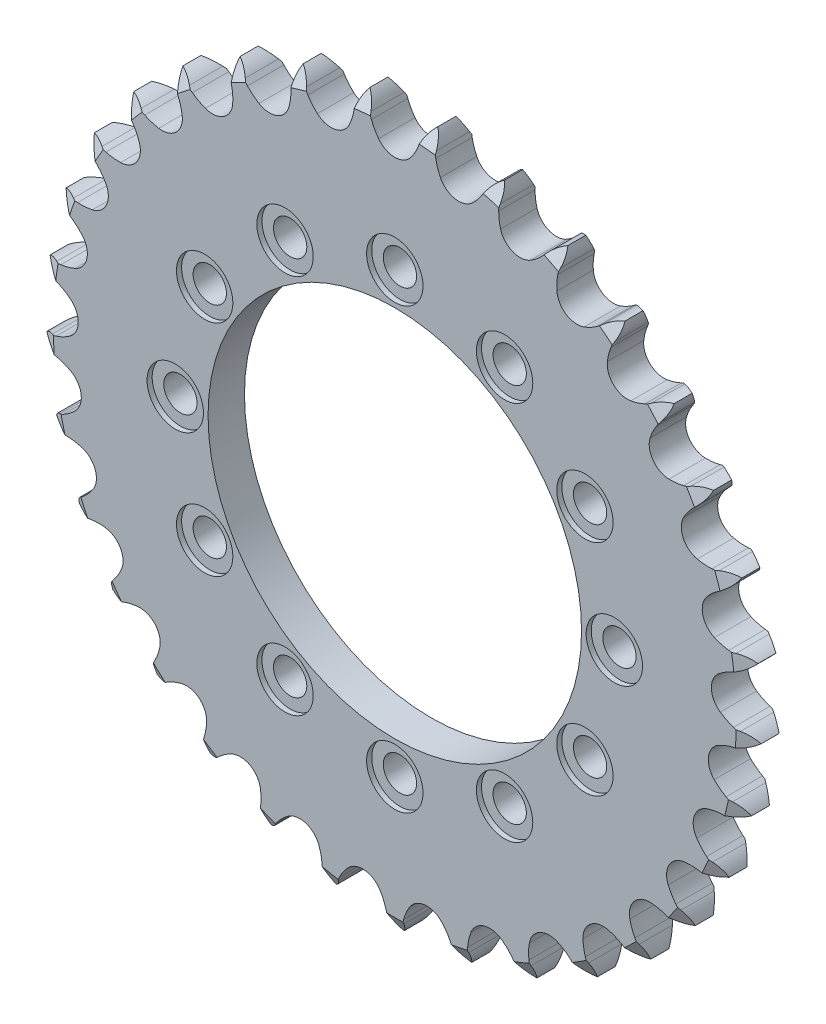
from build123d import *

# Parameters (mm, degrees)
EXTRUSION_DEPTH         = 7.2136
CIRPATTERN1_COUNT       = 12
CUT_EXTRUDE1_DEPTH      = 101.397293257
CUT_EXTRUDE1_DEPTH_BACK = 101.397293257
SKETCH8_R               = 37
CUT_EXTRUDE2_START      = 7.2136
SKETCH10_R              = 5.588
CUT_EXTRUDE2_DEPTH      = 1.016
CIRPATTERN2_COUNT       = 12


with BuildPart() as part:
    # Teeth Sketch → Extrusion (new body)
    with BuildSketch(Plane.XY):
        with BuildLine():
            ThreePointArc((6.734552875, 70.527428506), (5.727412099, 69.369502295), (5.022388138, 68.006393031))
            Line((5.022388138, 68.006393031), (4.635162245, 66.971544668))
            ThreePointArc((4.635162245, 66.971544668), (4.0137299, 65.635158722), (3.209237245, 64.400291471))
            ThreePointArc((3.209237245, 64.400291471), (0, 62.793862006), (-3.209237245, 64.400291471))
            ThreePointArc((-3.209237245, 64.400291471), (-4.0137299, 65.635158722), (-4.635162245, 66.971544668))
            Line((-4.635162245, 66.971544668), (-5.022388138, 68.006393031))
            ThreePointArc((-5.022388138, 68.006393031), (-5.727412099, 69.369502295), (-6.734552875, 70.527428506))
            ThreePointArc((-6.734552875, 70.527428506), (-7.504354329, 69.199824885), (-7.938667464, 67.727922119))
            Line((-7.938667464, 67.727922119), (-8.123049341, 66.638491832))
            ThreePointArc((-8.123049341, 66.638491832), (-8.48033889, 65.208649276), (-9.036593151, 63.84384645))
            ThreePointArc((-9.036593151, 63.84384645), (-11.883816523, 61.659095115), (-15.339077445, 62.629142165))
            ThreePointArc((-15.339077445, 62.629142165), (-16.362732034, 63.68944252), (-17.22584699, 64.884071387))
            Line((-17.22584699, 64.884071387), (-17.801921547, 65.826935709))
            ThreePointArc((-17.801921547, 65.826935709), (-18.752174931, 67.031985151), (-19.960254337, 67.978383482))
            ThreePointArc((-19.960254337, 67.978383482), (-20.464893839, 66.529085505), (-20.61279894, 65.001587639))
            Line((-20.61279894, 65.001587639), (-20.587672758, 63.896950277))
            ThreePointArc((-20.587672758, 63.896950277), (-20.667906137, 62.425329346), (-20.955817525, 60.979918474))
            ThreePointArc((-20.955817525, 60.979918474), (-23.338120953, 58.295807876), (-26.914523421, 58.594412483))
            ThreePointArc((-26.914523421, 58.594412483), (-28.120342399, 59.441823925), (-29.193944743, 60.451518712))
            Line((-29.193944743, 60.451518712), (-29.938047129, 61.268321421))
            ThreePointArc((-29.938047129, 61.268321421), (-31.099185303, 62.271757414), (-32.464540202, 62.972422563))
            ThreePointArc((-32.464540202, 62.972422563), (-32.685778765, 61.453811636), (-32.541930156, 59.925926421))
            Line((-32.541930156, 59.925926421), (-32.308204042, 58.846006456))
            ThreePointArc((-32.308204042, 58.846006456), (-32.108481407, 57.385795366), (-32.117644055, 55.912017363))
            ThreePointArc((-32.117644055, 55.912017363), (-33.948924886, 52.825558252), (-37.517208396, 52.441928068))
            ThreePointArc((-37.517208396, 52.441928068), (-38.861610323, 53.045822938), (-40.106897269, 53.834090646))
            Line((-40.106897269, 53.834090646), (-40.992133685, 54.495310364))
            ThreePointArc((-40.992133685, 54.495310364), (-42.32219009, 55.260866117), (-43.795472998, 55.69047422))
            ThreePointArc((-43.795472998, 55.69047422), (-43.725314484, 54.157436897), (-43.294911229, 52.684386087))
            Line((-43.294911229, 52.684386087), (-42.861032653, 51.668214641))
            ThreePointArc((-42.861032653, 51.668214641), (-42.388572501, 50.272189225), (-42.118655247, 48.823310267))
            ThreePointArc((-42.118655247, 48.823310267), (-43.33272622, 45.446055318), (-46.763923708, 44.394055736))
            ThreePointArc((-46.763923708, 44.394055736), (-48.198318397, 44.732607702), (-49.570282031, 45.270958281))
            Line((-49.570282031, 45.270958281), (-50.564657725, 45.752696804))
            ThreePointArc((-50.564657725, 45.752696804), (-52.015560657, 46.252703137), (-53.543523293, 46.395727039))
            ThreePointArc((-53.543523293, 46.395727039), (-53.184503413, 44.903671283), (-52.483101407, 43.538694772))
            Line((-52.483101407, 43.538694772), (-51.864751871, 42.622998928))
            ThreePointArc((-51.864751871, 42.622998928), (-51.136630142, 41.341615182), (-50.597388499, 39.970001531))
            ThreePointArc((-50.597388499, 39.970001531), (-51.150369926, 36.424013535), (-54.320468976, 34.741666562))
            ThreePointArc((-54.320468976, 34.741666562), (-55.793013665, 34.802639473), (-57.242067645, 35.071615531))
            Line((-57.242067645, 35.071615531), (-58.309643291, 35.356461573))
            ThreePointArc((-58.309643291, 35.356461573), (-59.828953337, 35.572846956), (-61.356371149, 35.424117399))
            ThreePointArc((-61.356371149, 35.424117399), (-60.721465817, 34.026969994), (-59.774415556, 32.819401589))
            Line((-59.774415556, 32.819401589), (-58.993943824, 32.037276981))
            ThreePointArc((-58.993943824, 32.037276981), (-58.036476735, 30.916847451), (-57.2474003, 29.672072798))
            ThreePointArc((-57.2474003, 29.672072798), (-57.119305992, 26.085513002), (-59.913730964, 23.83362304))
            ThreePointArc((-59.913730964, 23.83362304), (-61.371204052, 23.614813176), (-62.844975793, 23.604693218))
            Line((-62.844975793, 23.604693218), (-63.947166423, 23.682351702))
            ThreePointArc((-63.947166423, 23.682351702), (-65.479971761, 23.607295402), (-66.951639889, 23.17218786))
            ThreePointArc((-66.951639889, 23.17218786), (-66.063796239, 21.920445353), (-64.905326586, 20.913929722))
            Line((-64.905326586, 20.913929722), (-63.99094094, 20.293644371))
            ThreePointArc((-63.99094094, 20.293644371), (-62.838733846, 19.374664301), (-61.828341898, 18.301718044))
            ThreePointArc((-61.828341898, 18.301718044), (-61.023801517, 14.804214063), (-63.341554612, 12.064170283))
            ThreePointArc((-63.341554612, 12.064170283), (-64.731279223, 11.573486003), (-66.176502774, 11.28463579))
            Line((-66.176502774, 11.28463579), (-67.273472348, 11.152299936))
            ThreePointArc((-67.273472348, 11.152299936), (-68.764373399, 10.788514683), (-70.127101923, 10.082755077))
            ThreePointArc((-70.127101923, 10.082755077), (-69.018408937, 9.021658703), (-67.690390004, 8.252573944))
            Line((-67.690390004, 8.252573944), (-66.675138724, 7.816546579))
            ThreePointArc((-66.675138724, 7.816546579), (-65.369835391, 7.132230303), (-64.174646128, 6.269891516))
            ThreePointArc((-64.174646128, 6.269891516), (-62.722737859, 2.987852256), (-64.480049441, -0.14131302))
            ThreePointArc((-64.480049441, -0.14131302), (-65.751797307, -0.886137108), (-67.116238523, -1.443277777))
            Line((-67.116238523, -1.443277777), (-68.168339704, -1.780825007))
            ThreePointArc((-68.168339704, -1.780825007), (-69.563451418, -2.420191065), (-70.767987779, -3.371094744))
            ThreePointArc((-70.767987779, -3.371094744), (-69.478516511, -4.203194198), (-68.028946362, -4.707051357))
            Line((-68.028946362, -4.707051357), (-66.949523274, -4.943061572))
            ThreePointArc((-66.949523274, -4.943061572), (-65.538300765, -5.367981082), (-64.201511441, -5.988545228))
            ThreePointArc((-64.201511441, -5.988545228), (-62.154711032, -8.936498316), (-63.288067282, -12.341688903))
            ThreePointArc((-63.288067282, -12.341688903), (-64.395874122, -13.313732915), (-65.630218543, -14.119027525))
            Line((-65.630218543, -14.119027525), (-66.599425651, -14.649586294))
            ThreePointArc((-66.599425651, -14.649586294), (-67.848325057, -15.541424803), (-68.851134172, -16.703104419))
            ThreePointArc((-68.851134172, -16.703104419), (-67.427489473, -17.276132709), (-65.908759351, -17.496551559))
            Line((-65.908759351, -17.496551559), (-64.804177617, -17.524014599))
            ThreePointArc((-64.804177617, -17.524014599), (-63.338041192, -17.674179644), (-61.907966855, -18.030540344))
            ThreePointArc((-61.907966855, -18.030540344), (-59.340251006, -20.537860555), (-59.808689476, -24.096003993))
            ThreePointArc((-59.808689476, -24.096003993), (-60.712516265, -25.260135726), (-61.772151467, -26.284478831))
            Line((-61.772151467, -26.284478831), (-62.623434833, -26.988873364))
            ThreePointArc((-62.623434833, -26.988873364), (-63.680983452, -28.100950955), (-64.445821187, -29.43142038))
            ThreePointArc((-64.445821187, -29.43142038), (-62.939457285, -29.724666771), (-61.406458053, -29.6536808))
            Line((-61.406458053, -29.6536808), (-60.316640136, -29.471604079))
            ThreePointArc((-60.316640136, -29.471604079), (-58.848579784, -29.341587304), (-57.376907048, -29.420864754))
            ThreePointArc((-57.376907048, -29.420864754), (-54.381079699, -31.396931003), (-54.167669802, -34.979426717))
            ThreePointArc((-54.167669802, -34.979426717), (-54.834849884, -36.293571418), (-55.681477891, -37.499940589))
            Line((-55.681477891, -37.499940589), (-56.384069915, -38.352712231))
            ThreePointArc((-56.384069915, -38.352712231), (-57.212045185, -39.644835523), (-57.711268312, -41.096008126))
            ThreePointArc((-57.711268312, -41.096008126), (-56.176629123, -41.09887393), (-54.684767369, -40.739048756))
            Line((-54.684767369, -40.739048756), (-53.649102126, -40.354013001))
            ThreePointArc((-53.649102126, -40.354013001), (-52.232177374, -39.94851355), (-50.772096325, -39.747842457))
            ThreePointArc((-50.772096325, -39.747842457), (-47.456434483, -41.12123456), (-46.56888941, -44.598601821))
            ThreePointArc((-46.56888941, -44.598601821), (-46.975309158, -46.015262876), (-47.578330627, -47.360056788))
            Line((-47.578330627, -47.360056788), (-48.106837804, -48.330384151))
            ThreePointArc((-48.106837804, -48.330384151), (-48.675314541, -49.755852442), (-48.890879835, -51.275279063))
            ThreePointArc((-48.890879835, -51.275279063), (-47.383431219, -50.987660703), (-45.986626711, -50.352001344))
            Line((-45.986626711, -50.352001344), (-45.042545785, -49.777922752))
            ThreePointArc((-45.042545785, -49.777922752), (-43.727967985, -49.111596431), (-42.332249756, -48.638229571))
            ThreePointArc((-42.332249756, -48.638229571), (-38.816590078, -49.35930956), (-37.28698802, -52.605867255))
            ThreePointArc((-37.28698802, -52.605867255), (-37.417958367, -54.073842843), (-37.75557853, -55.50845714))
            Line((-37.75557853, -55.50845714), (-38.090899233, -56.561270064))
            ThreePointArc((-38.090899233, -56.561270064), (-38.379331208, -58.068563217), (-38.303447577, -59.601327819))
            ThreePointArc((-38.303447577, -59.601327819), (-36.877672653, -59.03362057), (-35.626409548, -58.145101414))
            Line((-35.626409548, -58.145101414), (-34.808034481, -57.402728679))
            ThreePointArc((-34.808034481, -57.402728679), (-33.6433159, -56.499658259), (-32.362405386, -55.770704343))
            ThreePointArc((-32.362405386, -55.770704343), (-28.773812973, -55.813410509), (-26.657437732, -58.711819583))
            ThreePointArc((-26.657437732, -58.711819583), (-26.508225068, -60.178053241), (-26.568241455, -61.650637225))
            Line((-26.568241455, -61.650637225), (-26.69825632, -62.747884308))
            ThreePointArc((-26.69825632, -62.747884308), (-26.696218847, -64.28252482), (-26.331628924, -65.773229298))
            ThreePointArc((-26.331628924, -65.773229298), (-25.039058915, -64.94595158), (-23.978561119, -63.836686022))
            Line((-23.978561119, -63.836686022), (-23.31547012, -62.952850431))
            ThreePointArc((-23.31547012, -62.952850431), (-22.342706722, -61.845675228), (-21.222899365, -60.887480551))
            ThreePointArc((-21.222899365, -60.887480551), (-17.691075297, -60.250269381), (-15.06441819, -62.69577378))
            ThreePointArc((-15.06441819, -62.69577378), (-14.640415448, -64.107272002), (-14.42065891, -65.564602652))
            Line((-14.42065891, -65.564602652), (-14.340668861, -66.666626525))
            ThreePointArc((-14.340668861, -66.666626525), (-14.048235582, -68.17314849), (-13.408116596, -69.567914899))
            ThreePointArc((-13.408116596, -69.567914899), (-12.295468348, -68.510966685), (-11.464065017, -67.221046473))
            Line((-11.464065017, -67.221046473), (-10.980223921, -66.227692145))
            ThreePointArc((-10.980223921, -66.227692145), (-10.23457391, -64.956428358), (-9.316342465, -63.80362457))
            ThreePointArc((-9.316342465, -63.80362457), (-5.968936066, -62.509526537), (-2.926931324, -64.413739359))
            ThreePointArc((-2.926931324, -64.413739359), (-2.24346307, -65.719486924), (-1.751876179, -67.108892511))
            Line((-1.751876179, -67.108892511), (-1.464772265, -68.175863162))
            ThreePointArc((-1.464772265, -68.175863162), (-0.89251248, -69.59981695), (0, -70.848234798))
            ThreePointArc((0, -70.848234798), (0.89251248, -69.59981695), (1.464772265, -68.175863162))
            Line((1.464772265, -68.175863162), (1.751876179, -67.108892511))
            ThreePointArc((1.751876179, -67.108892511), (2.24346307, -65.719486924), (2.926931324, -64.413739359))
            ThreePointArc((2.926931324, -64.413739359), (5.968936066, -62.509526537), (9.316342465, -63.80362457))
            ThreePointArc((9.316342465, -63.80362457), (10.23457391, -64.956428358), (10.980223921, -66.227692145))
            Line((10.980223921, -66.227692145), (11.464065017, -67.221046473))
            ThreePointArc((11.464065017, -67.221046473), (12.295468348, -68.510966685), (13.408116596, -69.567914899))
            ThreePointArc((13.408116596, -69.567914899), (14.048235582, -68.17314849), (14.340668861, -66.666626525))
            Line((14.340668861, -66.666626525), (14.42065891, -65.564602652))
            ThreePointArc((14.42065891, -65.564602652), (14.640415448, -64.107272002), (15.06441819, -62.69577378))
            ThreePointArc((15.06441819, -62.69577378), (17.691075297, -60.250269381), (21.222899365, -60.887480551))
            ThreePointArc((21.222899365, -60.887480551), (22.342706722, -61.845675228), (23.31547012, -62.952850431))
            Line((23.31547012, -62.952850431), (23.978561119, -63.836686022))
            ThreePointArc((23.978561119, -63.836686022), (25.039058915, -64.94595158), (26.331628924, -65.773229298))
            ThreePointArc((26.331628924, -65.773229298), (26.696218847, -64.28252482), (26.69825632, -62.747884308))
            Line((26.69825632, -62.747884308), (26.568241455, -61.650637225))
            ThreePointArc((26.568241455, -61.650637225), (26.508225068, -60.178053241), (26.657437732, -58.711819583))
            ThreePointArc((26.657437732, -58.711819583), (28.773812973, -55.813410509), (32.362405386, -55.770704343))
            ThreePointArc((32.362405386, -55.770704343), (33.6433159, -56.499658259), (34.808034481, -57.402728679))
            Line((34.808034481, -57.402728679), (35.626409548, -58.145101414))
            ThreePointArc((35.626409548, -58.145101414), (36.877672653, -59.03362057), (38.303447577, -59.601327819))
            ThreePointArc((38.303447577, -59.601327819), (38.379331208, -58.068563217), (38.090899233, -56.561270064))
            Line((38.090899233, -56.561270064), (37.75557853, -55.50845714))
            ThreePointArc((37.75557853, -55.50845714), (37.417958367, -54.073842843), (37.28698802, -52.605867255))
            ThreePointArc((37.28698802, -52.605867255), (38.816590078, -49.35930956), (42.332249756, -48.638229571))
            ThreePointArc((42.332249756, -48.638229571), (43.727967985, -49.111596431), (45.042545785, -49.777922752))
            Line((45.042545785, -49.777922752), (45.986626711, -50.352001344))
            ThreePointArc((45.986626711, -50.352001344), (47.383431219, -50.987660703), (48.890879835, -51.275279063))
            ThreePointArc((48.890879835, -51.275279063), (48.675314541, -49.755852442), (48.106837804, -48.330384151))
            Line((48.106837804, -48.330384151), (47.578330627, -47.360056788))
            ThreePointArc((47.578330627, -47.360056788), (46.975309158, -46.015262876), (46.56888941, -44.598601821))
            ThreePointArc((46.56888941, -44.598601821), (47.456434483, -41.12123456), (50.772096325, -39.747842457))
            ThreePointArc((50.772096325, -39.747842457), (52.232177374, -39.94851355), (53.649102126, -40.354013001))
            Line((53.649102126, -40.354013001), (54.684767369, -40.739048756))
            ThreePointArc((54.684767369, -40.739048756), (56.176629123, -41.09887393), (57.711268312, -41.096008126))
            ThreePointArc((57.711268312, -41.096008126), (57.212045185, -39.644835523), (56.384069915, -38.352712231))
            Line((56.384069915, -38.352712231), (55.681477891, -37.499940589))
            ThreePointArc((55.681477891, -37.499940589), (54.834849884, -36.293571418), (54.167669802, -34.979426717))
            ThreePointArc((54.167669802, -34.979426717), (54.381079699, -31.396931003), (57.376907048, -29.420864754))
            ThreePointArc((57.376907048, -29.420864754), (58.848579784, -29.341587304), (60.316640136, -29.471604079))
            Line((60.316640136, -29.471604079), (61.406458053, -29.6536808))
            ThreePointArc((61.406458053, -29.6536808), (62.939457285, -29.724666771), (64.445821187, -29.43142038))
            ThreePointArc((64.445821187, -29.43142038), (63.680983452, -28.100950955), (62.623434833, -26.988873364))
            Line((62.623434833, -26.988873364), (61.772151467, -26.284478831))
            ThreePointArc((61.772151467, -26.284478831), (60.712516265, -25.260135726), (59.808689476, -24.096003993))
            ThreePointArc((59.808689476, -24.096003993), (59.340251006, -20.537860555), (61.907966855, -18.030540344))
            ThreePointArc((61.907966855, -18.030540344), (63.338041192, -17.674179644), (64.804177617, -17.524014599))
            Line((64.804177617, -17.524014599), (65.908759351, -17.496551559))
            ThreePointArc((65.908759351, -17.496551559), (67.427489473, -17.276132709), (68.851134172, -16.703104419))
            ThreePointArc((68.851134172, -16.703104419), (67.848325057, -15.541424803), (66.599425651, -14.649586294))
            Line((66.599425651, -14.649586294), (65.630218543, -14.119027525))
            ThreePointArc((65.630218543, -14.119027525), (64.395874122, -13.313732915), (63.288067282, -12.341688903))
            ThreePointArc((63.288067282, -12.341688903), (62.154711032, -8.936498316), (64.201511441, -5.988545228))
            ThreePointArc((64.201511441, -5.988545228), (65.538300765, -5.367981082), (66.949523274, -4.943061572))
            Line((66.949523274, -4.943061572), (68.028946362, -4.707051357))
            ThreePointArc((68.028946362, -4.707051357), (69.478516511, -4.203194198), (70.767987779, -3.371094744))
            ThreePointArc((70.767987779, -3.371094744), (69.563451418, -2.420191065), (68.168339704, -1.780825007))
            Line((68.168339704, -1.780825007), (67.116238523, -1.443277777))
            ThreePointArc((67.116238523, -1.443277777), (65.751797307, -0.886137108), (64.480049441, -0.14131302))
            ThreePointArc((64.480049441, -0.14131302), (62.722737859, 2.987852256), (64.174646128, 6.269891516))
            ThreePointArc((64.174646128, 6.269891516), (65.369835391, 7.132230303), (66.675138724, 7.816546579))
            Line((66.675138724, 7.816546579), (67.690390004, 8.252573944))
            ThreePointArc((67.690390004, 8.252573944), (69.018408937, 9.021658703), (70.127101923, 10.082755077))
            ThreePointArc((70.127101923, 10.082755077), (68.764373399, 10.788514683), (67.273472348, 11.152299936))
            Line((67.273472348, 11.152299936), (66.176502774, 11.28463579))
            ThreePointArc((66.176502774, 11.28463579), (64.731279223, 11.573486003), (63.341554612, 12.064170283))
            ThreePointArc((63.341554612, 12.064170283), (61.023801517, 14.804214063), (61.828341898, 18.301718044))
            ThreePointArc((61.828341898, 18.301718044), (62.838733846, 19.374664301), (63.99094094, 20.293644371))
            Line((63.99094094, 20.293644371), (64.905326586, 20.913929722))
            ThreePointArc((64.905326586, 20.913929722), (66.063796239, 21.920445353), (66.951639889, 23.17218786))
            ThreePointArc((66.951639889, 23.17218786), (65.479971761, 23.607295402), (63.947166423, 23.682351702))
            Line((63.947166423, 23.682351702), (62.844975793, 23.604693218))
            ThreePointArc((62.844975793, 23.604693218), (61.371204052, 23.614813176), (59.913730964, 23.83362304))
            ThreePointArc((59.913730964, 23.83362304), (57.119305992, 26.085513002), (57.2474003, 29.672072798))
            ThreePointArc((57.2474003, 29.672072798), (58.036476735, 30.916847451), (58.993943824, 32.037276981))
            Line((58.993943824, 32.037276981), (59.774415556, 32.819401589))
            ThreePointArc((59.774415556, 32.819401589), (60.721465817, 34.026969994), (61.356371149, 35.424117399))
            ThreePointArc((61.356371149, 35.424117399), (59.828953337, 35.572846956), (58.309643291, 35.356461573))
            Line((58.309643291, 35.356461573), (57.242067645, 35.071615531))
            ThreePointArc((57.242067645, 35.071615531), (55.793013665, 34.802639473), (54.320468976, 34.741666562))
            ThreePointArc((54.320468976, 34.741666562), (51.150369926, 36.424013535), (50.597388499, 39.970001531))
            ThreePointArc((50.597388499, 39.970001531), (51.136630142, 41.341615182), (51.864751871, 42.622998928))
            Line((51.864751871, 42.622998928), (52.483101407, 43.538694772))
            ThreePointArc((52.483101407, 43.538694772), (53.184503413, 44.903671283), (53.543523293, 46.395727039))
            ThreePointArc((53.543523293, 46.395727039), (52.015560657, 46.252703137), (50.564657725, 45.752696804))
            Line((50.564657725, 45.752696804), (49.570282031, 45.270958281))
            ThreePointArc((49.570282031, 45.270958281), (48.198318397, 44.732607702), (46.763923708, 44.394055736))
            ThreePointArc((46.763923708, 44.394055736), (43.33272622, 45.446055318), (42.118655247, 48.823310267))
            ThreePointArc((42.118655247, 48.823310267), (42.388572501, 50.272189225), (42.861032653, 51.668214641))
            Line((42.861032653, 51.668214641), (43.294911229, 52.684386087))
            ThreePointArc((43.294911229, 52.684386087), (43.725314484, 54.157436897), (43.795472998, 55.69047422))
            ThreePointArc((43.795472998, 55.69047422), (42.32219009, 55.260866117), (40.992133685, 54.495310364))
            Line((40.992133685, 54.495310364), (40.106897269, 53.834090646))
            ThreePointArc((40.106897269, 53.834090646), (38.861610323, 53.045822938), (37.517208396, 52.441928068))
            ThreePointArc((37.517208396, 52.441928068), (33.948924886, 52.825558252), (32.117644055, 55.912017363))
            ThreePointArc((32.117644055, 55.912017363), (32.108481407, 57.385795366), (32.308204042, 58.846006456))
            Line((32.308204042, 58.846006456), (32.541930156, 59.925926421))
            ThreePointArc((32.541930156, 59.925926421), (32.685778765, 61.453811636), (32.464540202, 62.972422563))
            ThreePointArc((32.464540202, 62.972422563), (31.099185303, 62.271757414), (29.938047129, 61.268321421))
            Line((29.938047129, 61.268321421), (29.193944743, 60.451518712))
            ThreePointArc((29.193944743, 60.451518712), (28.120342399, 59.441823925), (26.914523421, 58.594412483))
            ThreePointArc((26.914523421, 58.594412483), (23.338120953, 58.295807876), (20.955817525, 60.979918474))
            ThreePointArc((20.955817525, 60.979918474), (20.667906137, 62.425329346), (20.587672758, 63.896950277))
            Line((20.587672758, 63.896950277), (20.61279894, 65.001587639))
            ThreePointArc((20.61279894, 65.001587639), (20.464893839, 66.529085505), (19.960254337, 67.978383482))
            ThreePointArc((19.960254337, 67.978383482), (18.752174931, 67.031985151), (17.801921547, 65.826935709))
            Line((17.801921547, 65.826935709), (17.22584699, 64.884071387))
            ThreePointArc((17.22584699, 64.884071387), (16.362732034, 63.68944252), (15.339077445, 62.629142165))
            ThreePointArc((15.339077445, 62.629142165), (11.883816523, 61.659095115), (9.036593151, 63.84384645))
            ThreePointArc((9.036593151, 63.84384645), (8.48033889, 65.208649276), (8.123049341, 66.638491832))
            Line((8.123049341, 66.638491832), (7.938667464, 67.727922119))
            ThreePointArc((7.938667464, 67.727922119), (7.504354329, 69.199824885), (6.734552875, 70.527428506))
        make_face()
    extrude(amount=EXTRUSION_DEPTH)

    # Sketch7 → M6 Clearance Hole1 (revolve, cut)
    with BuildSketch(Plane(origin=(0, 43.500000122, 0), x_dir=(0, 1, 0), z_dir=(1, 0, 0))):
        Polygon((0, 0), (0, 19.254840043), (3.3, 17.272), (3.3, 0), align=None)
    m6_clearance_hole1 = revolve(axis=Axis((0, 43.500000122, -6.35), (0, 0, 1)), mode=Mode.SUBTRACT)

    # CirPattern1: M6 Clearance Hole1 ×12 about axis
    cirpattern1_axis = Axis((0, 0, 0), (0, 0, 1))
    for i in range(1, CIRPATTERN1_COUNT):
        add(m6_clearance_hole1.rotate(cirpattern1_axis, i * 360 / CIRPATTERN1_COUNT), mode=Mode.SUBTRACT)

    # Sketch8 → Cut-Extrude1 (cut, two sides: drawn at the far end of the back side and taken through both)
    with BuildSketch(Plane(origin=(0, 0, 0), x_dir=(-1, 0, 0), z_dir=(0, 0, -1)).offset(-CUT_EXTRUDE1_DEPTH_BACK)):
        Circle(SKETCH8_R)
    extrude(amount=CUT_EXTRUDE1_DEPTH + CUT_EXTRUDE1_DEPTH_BACK, mode=Mode.SUBTRACT)

    # Sketch5 → Cut-Revolve1 (revolve, cut)
    with BuildSketch(Plane(origin=(0, 0, 0), x_dir=(0, 0, -1), z_dir=(1, 0, 0))):
        Polygon((-7.2136, -67.654652666), (-7.2136, -70.848234798), (-5.3848, -70.848234798), align=None)
    cut_revolve1 = revolve(axis=Axis((0, 0, 7.2136), (0, 0, -1)), mode=Mode.SUBTRACT)

    # Mirror1: Cut-Revolve1 across plane
    add(cut_revolve1.mirror(Plane.XY.offset(3.6068)), mode=Mode.SUBTRACT)

    # Sketch10 → Cut-Extrude2 (cut)
    with BuildSketch(Plane.XY.offset(CUT_EXTRUDE2_START)):
        with Locations((-43.500000122, 0)):
            Circle(SKETCH10_R)
    cut_extrude2 = extrude(amount=-CUT_EXTRUDE2_DEPTH, mode=Mode.SUBTRACT)

    # CirPattern2: Cut-Extrude2 ×12 about axis
    cirpattern2_axis = Axis((0, 0, 0), (0, 0, 1))
    for i in range(1, CIRPATTERN2_COUNT):
        add(cut_extrude2.rotate(cirpattern2_axis, i * 360 / CIRPATTERN2_COUNT), mode=Mode.SUBTRACT)


solid = part.part
